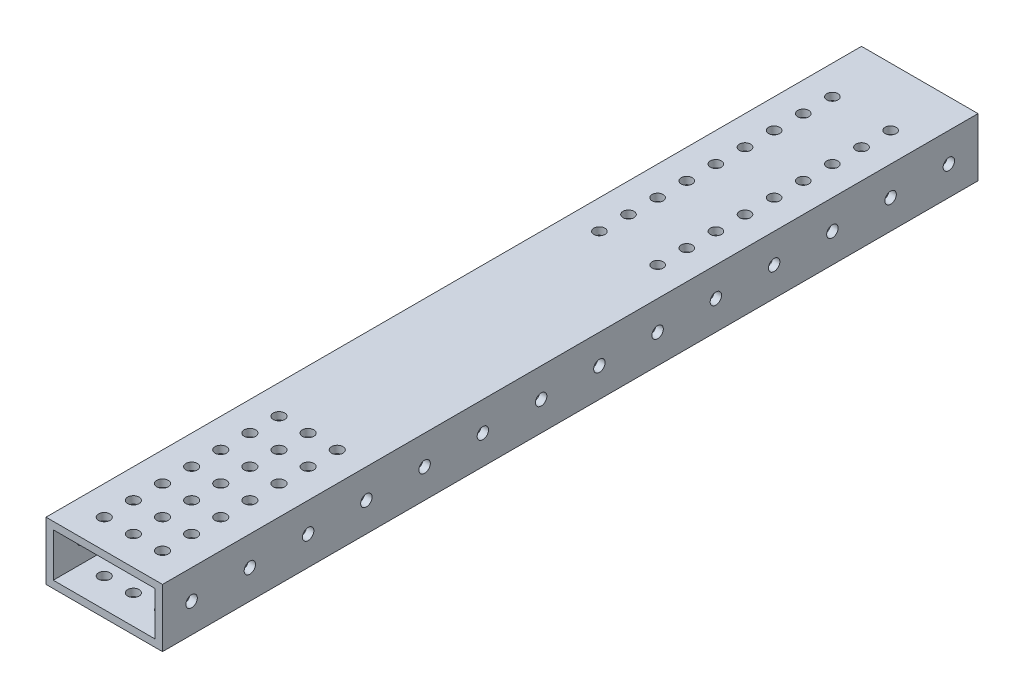
from build123d import *

# Parameters (mm, degrees)
SKETCH1_W           = 50.8
SKETCH1_H           = 25.4
SKETCH1_W_2         = 44.45
SKETCH1_H_2         = 19.05
BOSS_EXTRUDE1_DEPTH = 177.8
SKETCH2_R           = 2.413
SKETCH2_R_2         = 2.4892
CUT_EXTRUDE1_DEPTH  = 182.392282085
SKETCH3_R           = 2.4892
CUT_EXTRUDE2_DEPTH  = 186.350397895


with BuildPart() as part:
    # Sketch1 → Boss-Extrude1 (new, symmetric)
    with BuildSketch(Plane.XY):
        Rectangle(SKETCH1_W, SKETCH1_H)
        Rectangle(SKETCH1_W_2, SKETCH1_H_2, mode=Mode.SUBTRACT)
    extrude(amount=BOSS_EXTRUDE1_DEPTH, both=True)

    # Sketch2 → Cut-Extrude1 (cut, through all)
    with BuildSketch(Plane.XZ.offset(12.7)):
        with Locations((12.7, -63.5)):
            Circle(SKETCH2_R)
        with Locations((12.7, -76.2)):
            Circle(SKETCH2_R)
        with Locations((12.7, -88.9)):
            Circle(SKETCH2_R)
        with Locations((12.7, -101.6)):
            Circle(SKETCH2_R)
        with Locations((12.7, -114.3)):
            Circle(SKETCH2_R)
        with Locations((12.7, -127)):
            Circle(SKETCH2_R)
        with Locations((12.7, -139.7)):
            Circle(SKETCH2_R)
        with Locations((12.7, -152.4)):
            Circle(SKETCH2_R)
        with Locations((-12.7, -152.4)):
            Circle(SKETCH2_R)
        with Locations((-12.7, -139.7)):
            Circle(SKETCH2_R)
        with Locations((-12.7, -127)):
            Circle(SKETCH2_R)
        with Locations((-12.7, -114.3)):
            Circle(SKETCH2_R)
        with Locations((-12.7, -101.6)):
            Circle(SKETCH2_R)
        with Locations((-12.7, -88.9)):
            Circle(SKETCH2_R)
        with Locations((-12.7, -76.2)):
            Circle(SKETCH2_R)
        with Locations((-12.7, -63.5)):
            Circle(SKETCH2_R)
        with Locations((-12.7, -50.8)):
            Circle(SKETCH2_R)
        with Locations((12.7, -50.8)):
            Circle(SKETCH2_R)
        with Locations((-12.7, 165.1)):
            Circle(SKETCH2_R_2)
        with Locations((-12.7, 152.4)):
            Circle(SKETCH2_R_2)
        with Locations((-12.7, 139.7)):
            Circle(SKETCH2_R_2)
        with Locations((-12.7, 127)):
            Circle(SKETCH2_R_2)
        with Locations((-12.7, 114.3)):
            Circle(SKETCH2_R_2)
        with Locations((-12.7, 101.6)):
            Circle(SKETCH2_R_2)
        with Locations((-12.7, 88.9)):
            Circle(SKETCH2_R_2)
        with Locations((0, 88.9)):
            Circle(SKETCH2_R_2)
        with Locations((0, 101.6)):
            Circle(SKETCH2_R_2)
        with Locations((0, 114.3)):
            Circle(SKETCH2_R_2)
        with Locations((0, 127)):
            Circle(SKETCH2_R_2)
        with Locations((0, 139.7)):
            Circle(SKETCH2_R_2)
        with Locations((0, 152.4)):
            Circle(SKETCH2_R_2)
        with Locations((0, 165.1)):
            Circle(SKETCH2_R_2)
        with Locations((12.7, 165.1)):
            Circle(SKETCH2_R_2)
        with Locations((12.7, 152.4)):
            Circle(SKETCH2_R_2)
        with Locations((12.7, 139.7)):
            Circle(SKETCH2_R_2)
        with Locations((12.7, 127)):
            Circle(SKETCH2_R_2)
        with Locations((12.7, 114.3)):
            Circle(SKETCH2_R_2)
        with Locations((12.7, 101.6)):
            Circle(SKETCH2_R_2)
        with Locations((12.7, 88.9)):
            Circle(SKETCH2_R_2)
    extrude(amount=-CUT_EXTRUDE1_DEPTH, mode=Mode.SUBTRACT)

    # Sketch3 → Cut-Extrude2 (cut, through all)
    with BuildSketch(Plane(origin=(25.4, 0, 0), x_dir=(0, 0, -1), z_dir=(1, 0, 0))):
        with Locations((-165.1, 0)):
            Circle(SKETCH3_R)
        with Locations((-139.7, 0)):
            Circle(SKETCH3_R)
        with Locations((-114.3, 0)):
            Circle(SKETCH3_R)
        with Locations((-88.9, 0)):
            Circle(SKETCH3_R)
        with Locations((-63.5, 0)):
            Circle(SKETCH3_R)
        with Locations((-38.1, 0)):
            Circle(SKETCH3_R)
        with Locations((-12.7, 0)):
            Circle(SKETCH3_R)
        with Locations((12.7, 0)):
            Circle(SKETCH3_R)
        with Locations((38.1, 0)):
            Circle(SKETCH3_R)
        with Locations((63.5, 0)):
            Circle(SKETCH3_R)
        with Locations((88.9, 0)):
            Circle(SKETCH3_R)
        with Locations((114.3, 0)):
            Circle(SKETCH3_R)
        with Locations((139.7, 0)):
            Circle(SKETCH3_R)
        with Locations((165.1, 0)):
            Circle(SKETCH3_R)
    extrude(amount=-CUT_EXTRUDE2_DEPTH, mode=Mode.SUBTRACT)


solid = part.part
